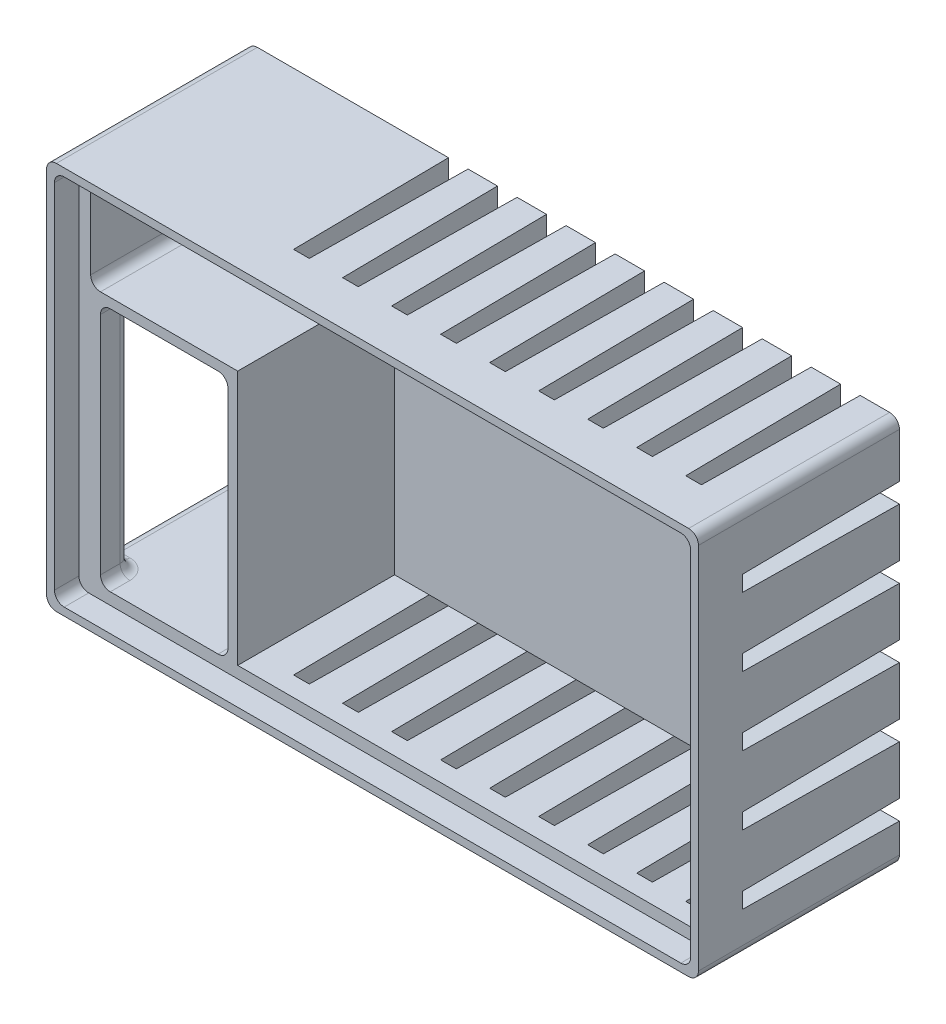
from build123d import *

# Parameters (mm, degrees)
SKETCH1_W            = 66.5
SKETCH1_H            = 39.6
BOSS_EXTRUDE1_DEPTH  = 2
SKETCH2_W            = 66.5
SKETCH2_H            = 39.6
SKETCH2_W_2          = 62.5
SKETCH2_H_2          = 35.6
BOSS_EXTRUDE2_DEPTH  = 16
SKETCH3_W            = 66.5
SKETCH3_H            = 39.6
SKETCH3_W_2          = 64.9
SKETCH3_H_2          = 38
BOSS_EXTRUDE3_DEPTH  = 2.5
SKETCH5_W            = 16
SKETCH5_H            = 25
CUT_EXTRUDE2_DEPTH   = 15
BOSS_EXTRUDE4_DEPTH  = 16
FILLET1_R            = 1
CUT_EXTRUDE3_DEPTH   = 2
LPATTERN1_COUNT      = 9
LPATTERN1_PITCH      = 5
MIRROR1_COPY_1_DEPTH = 2
MIRROR1_COPY_2_DEPTH = 2
MIRROR1_COPY_3_DEPTH = 2
MIRROR1_COPY_4_DEPTH = 2
MIRROR1_COPY_5_DEPTH = 2
MIRROR1_COPY_6_DEPTH = 2
MIRROR1_COPY_7_DEPTH = 2
MIRROR1_COPY_8_DEPTH = 2
CUT_EXTRUDE4_DEPTH   = 2
LPATTERN2_COUNT      = 5
LPATTERN2_PITCH      = 7
SKETCH9_W            = 1
SKETCH9_H            = 25
BOSS_EXTRUDE5_DEPTH  = 3
FILLET2_R            = 1
SKETCH10_W           = 12
SKETCH10_H           = 24
CUT_EXTRUDE5_DEPTH   = 0.4
FILLET3_R            = 2


with BuildPart() as part:
    # Sketch1 → Boss-Extrude1 (new body)
    with BuildSketch(Plane.XY):
        with Locations((33.25, 19.8)):
            Rectangle(SKETCH1_W, SKETCH1_H)
    extrude(amount=BOSS_EXTRUDE1_DEPTH)

    # Sketch2 → Boss-Extrude2 (add)
    with BuildSketch(Plane.XY.offset(2)):
        with Locations((33.25, 19.8)):
            Rectangle(SKETCH2_W, SKETCH2_H)
        with Locations((33.25, 19.8)):
            Rectangle(SKETCH2_W_2, SKETCH2_H_2, mode=Mode.SUBTRACT)
    extrude(amount=BOSS_EXTRUDE2_DEPTH)

    # Sketch3 → Boss-Extrude3 (add)
    with BuildSketch(Plane.XY.offset(18)):
        with Locations((33.25, 19.8)):
            Rectangle(SKETCH3_W, SKETCH3_H)
        with Locations((33.25, 19.8)):
            Rectangle(SKETCH3_W_2, SKETCH3_H_2, mode=Mode.SUBTRACT)
    extrude(amount=BOSS_EXTRUDE3_DEPTH)

    # Sketch5 → Cut-Extrude2 (cut)
    with BuildSketch(Plane(origin=(0, 0, 0), x_dir=(-1, 0, 0), z_dir=(0, 0, -1))):
        with Locations((-8, 14.5)):
            Rectangle(SKETCH5_W, SKETCH5_H)
    extrude(amount=-CUT_EXTRUDE2_DEPTH, mode=Mode.SUBTRACT)

    # Sketch6 → Boss-Extrude4 (add)
    with BuildSketch(Plane.XY.offset(2)):
        Polygon((2, 27), (16, 27), (16, 2), (17, 2), (17, 28), (2, 28), align=None)
    extrude(amount=BOSS_EXTRUDE4_DEPTH)

    # Fillet1
    fillet1_edges = [part.edges().sort_by_distance(p)[0] for p in [
        (64.5, 37.6, 10),
        (2, 37.6, 10),
        (64.5, 2, 10),
        (65.7, 38.8, 19.25),
        (0.8, 38.8, 19.25),
        (0.8, 0.8, 19.25),
        (65.7, 0.8, 19.25),
        (0, 39.6, 10.25),
        (66.5, 39.6, 10.25),
        (66.5, 0, 10.25),
        (0, 0, 10.25),
        (2, 28, 10),
    ]]
    fillet(fillet1_edges, radius=FILLET1_R)

    # Sketch7 → Cut-Extrude3 (cut)
    with BuildSketch(Plane(origin=(0, 39.6, 0), x_dir=(1, 0, 0), z_dir=(0, 1, 0))):
        Polygon((62.5, 0), (62.3, -16), (60.7, -16), (60.5, 0), align=None)
    cut_extrude3 = extrude(amount=-CUT_EXTRUDE3_DEPTH, mode=Mode.SUBTRACT)

    # LPattern1: Cut-Extrude3 ×9
    with Locations(*[(-i * LPATTERN1_PITCH, 0, 0) for i in range(1, LPATTERN1_COUNT)]):
        add(cut_extrude3, mode=Mode.SUBTRACT)

    # Mirror1: Cut-Extrude3 across plane
    add(cut_extrude3.mirror(Plane.ZX.offset(19.8)), mode=Mode.SUBTRACT)

    # Mirror1 copy 1 sketch → Mirror1 copy 1 (cut)
    with BuildSketch(Plane(origin=(-5, 0, 0), x_dir=(1, 0, 0), z_dir=(0, -1, 0))):
        Polygon((62.5, 0), (62.3, 16), (60.7, 16), (60.5, 0), align=None)
    extrude(amount=-MIRROR1_COPY_1_DEPTH, mode=Mode.SUBTRACT)

    # Mirror1 copy 2 sketch → Mirror1 copy 2 (cut)
    with BuildSketch(Plane(origin=(-10, 0, 0), x_dir=(1, 0, 0), z_dir=(0, -1, 0))):
        Polygon((62.5, 0), (62.3, 16), (60.7, 16), (60.5, 0), align=None)
    extrude(amount=-MIRROR1_COPY_2_DEPTH, mode=Mode.SUBTRACT)

    # Mirror1 copy 3 sketch → Mirror1 copy 3 (cut)
    with BuildSketch(Plane(origin=(-15, 0, 0), x_dir=(1, 0, 0), z_dir=(0, -1, 0))):
        Polygon((62.5, 0), (62.3, 16), (60.7, 16), (60.5, 0), align=None)
    extrude(amount=-MIRROR1_COPY_3_DEPTH, mode=Mode.SUBTRACT)

    # Mirror1 copy 4 sketch → Mirror1 copy 4 (cut)
    with BuildSketch(Plane(origin=(-20, 0, 0), x_dir=(1, 0, 0), z_dir=(0, -1, 0))):
        Polygon((62.5, 0), (62.3, 16), (60.7, 16), (60.5, 0), align=None)
    extrude(amount=-MIRROR1_COPY_4_DEPTH, mode=Mode.SUBTRACT)

    # Mirror1 copy 5 sketch → Mirror1 copy 5 (cut)
    with BuildSketch(Plane(origin=(-25, 0, 0), x_dir=(1, 0, 0), z_dir=(0, -1, 0))):
        Polygon((62.5, 0), (62.3, 16), (60.7, 16), (60.5, 0), align=None)
    extrude(amount=-MIRROR1_COPY_5_DEPTH, mode=Mode.SUBTRACT)

    # Mirror1 copy 6 sketch → Mirror1 copy 6 (cut)
    with BuildSketch(Plane(origin=(-30, 0, 0), x_dir=(1, 0, 0), z_dir=(0, -1, 0))):
        Polygon((62.5, 0), (62.3, 16), (60.7, 16), (60.5, 0), align=None)
    extrude(amount=-MIRROR1_COPY_6_DEPTH, mode=Mode.SUBTRACT)

    # Mirror1 copy 7 sketch → Mirror1 copy 7 (cut)
    with BuildSketch(Plane(origin=(-35, 0, 0), x_dir=(1, 0, 0), z_dir=(0, -1, 0))):
        Polygon((62.5, 0), (62.3, 16), (60.7, 16), (60.5, 0), align=None)
    extrude(amount=-MIRROR1_COPY_7_DEPTH, mode=Mode.SUBTRACT)

    # Mirror1 copy 8 sketch → Mirror1 copy 8 (cut)
    with BuildSketch(Plane(origin=(-40, 0, 0), x_dir=(1, 0, 0), z_dir=(0, -1, 0))):
        Polygon((62.5, 0), (62.3, 16), (60.7, 16), (60.5, 0), align=None)
    extrude(amount=-MIRROR1_COPY_8_DEPTH, mode=Mode.SUBTRACT)

    # Sketch8 → Cut-Extrude4 (cut)
    with BuildSketch(Plane(origin=(66.5, 0, 0), x_dir=(0, 0, -1), z_dir=(1, 0, 0))):
        Polygon((0, 6), (0, 4), (-16, 4.2), (-16, 5.8), align=None)
    cut_extrude4 = extrude(amount=-CUT_EXTRUDE4_DEPTH, mode=Mode.SUBTRACT)

    # LPattern2: Cut-Extrude4 ×5
    with Locations(*[(0, i * LPATTERN2_PITCH, 0) for i in range(1, LPATTERN2_COUNT)]):
        add(cut_extrude4, mode=Mode.SUBTRACT)

    # Sketch9 → Boss-Extrude5 (add)
    with BuildSketch(Plane(origin=(0, 0, 15), x_dir=(-1, 0, 0), z_dir=(0, 0, -1))):
        with Locations((-2.5, 14.5)):
            Rectangle(SKETCH9_W, SKETCH9_H)
    extrude(amount=-BOSS_EXTRUDE5_DEPTH)

    # Fillet2
    fillet2_edges = [part.edges().sort_by_distance(p)[0] for p in [
        (3, 14.5, 15),
        (3, 27, 16.5),
        (3, 2, 16.5),
        (16, 2, 9),
        (0, 14.5, 15),
        (0, 27, 7.5),
        (1.5, 2, 15),
        (0, 2, 7.5),
        (16, 27, 9),
        (1.5, 27, 15),
    ]]
    fillet(fillet2_edges, radius=FILLET2_R - 0.0001)  # a hair under: the kernel refuses the full size

    # Sketch10 → Cut-Extrude5 (cut)
    with BuildSketch(Plane(origin=(0, 0, 0), x_dir=(-1, 0, 0), z_dir=(0, 0, -1))):
        with Locations((-23, 15)):
            Rectangle(SKETCH10_W, SKETCH10_H)
    extrude(amount=-CUT_EXTRUDE5_DEPTH, mode=Mode.SUBTRACT)

    # Fillet3
    fillet3_edges = [part.edges().sort_by_distance(p)[0] for p in [
        (17, 27, 0.2),
        (17, 3, 0.2),
        (29, 3, 0.2),
        (29, 27, 0.2),
    ]]
    fillet(fillet3_edges, radius=FILLET3_R)


solid = part.part
